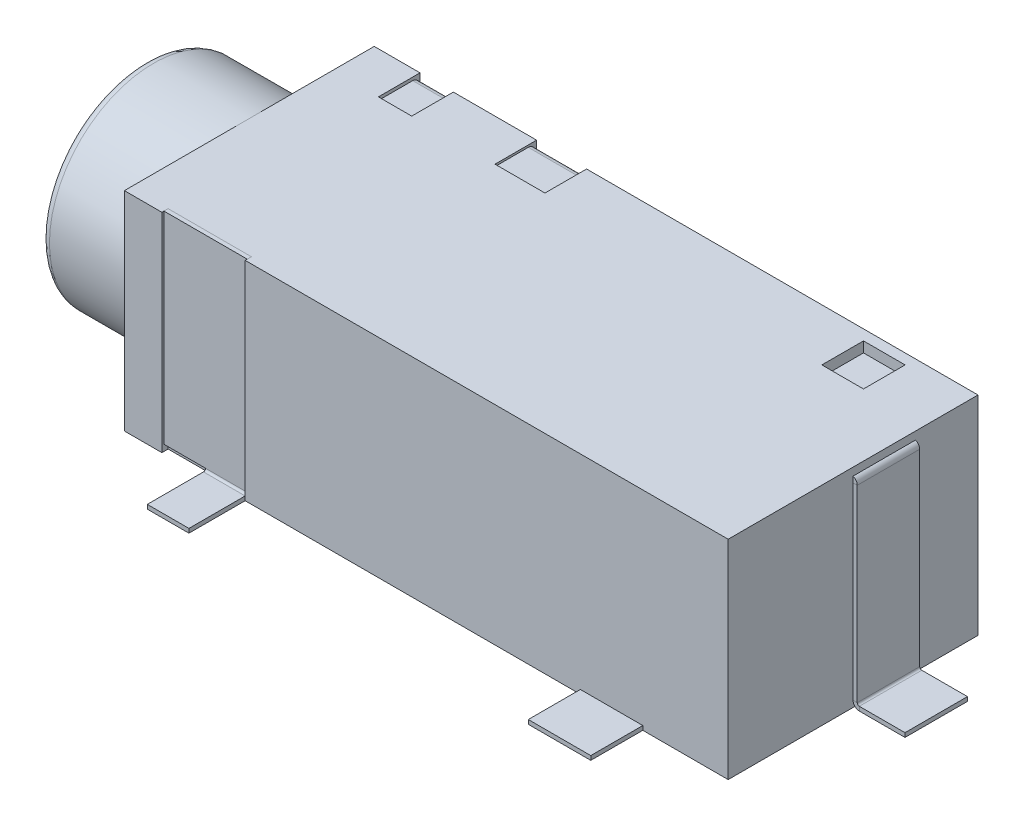
from build123d import *

# Parameters (mm, degrees)
SKETCH1_W               = 14.5
SKETCH1_H               = 6
BOSS_EXTRUDE1_DEPTH     = 5
SKETCH2_R               = 2.5
SKETCH2_R_2             = 1.8
BOSS_EXTRUDE2_DEPTH     = 2.5
CUT_EXTRUDE1_START      = -13.5
SKETCH2_2_R             = 1.8
CUT_EXTRUDE1_DEPTH      = 13.5
SKETCH3_W               = 1
SKETCH3_H               = 1
CUT_EXTRUDE2_DEPTH      = 0.25
BASE_FLANGE1_DEPTH      = 0.75
SKETCH9_W               = 1.25
SKETCH9_H               = 0.1
BASE_FLANGE2_DEPTH      = 0.75
CUT_EXTRUDE3_DEPTH      = 0.15
BASE_FLANGE3_DEPTH      = 0.5
SKETCH17_W              = 0.1
SKETCH17_H              = 4.85
BOSS_EXTRUDE3_DEPTH     = 1
SKETCH20_W              = 0.8
SKETCH20_H              = 1
CUT_EXTRUDE4_DEPTH      = 0.15
SKETCH21_W              = 0.8
SKETCH21_H              = 5
CUT_EXTRUDE5_DEPTH      = 0.15
BASE_FLANGE4_DEPTH      = 0.375
CUT_EXTRUDE6_DEPTH      = 0.15
SKETCH27_W              = 1.2
SKETCH27_H              = 1
CUT_EXTRUDE7_DEPTH      = 0.15
BASE_FLANGE5_DEPTH      = 0.4
BASE_FLANGE5_DEPTH_BACK = 0.8
SKETCH31_W              = 0.45
SKETCH31_H              = 1.5
CUT_EXTRUDE8_DEPTH      = 0.15
CHAMFER1_SIZE           = 0.2
FILLET1_R               = 0.2
SKETCH33_R              = 1
BOSS_EXTRUDE4_DEPTH     = 0.8
CHAMFER2_SIZE           = 0.25


# Sheet-metal steps are written as plain solids
with BuildPart() as part:
    # Sketch1 → Boss-Extrude1 (new body)
    with BuildSketch(Plane(origin=(0, 0, 0), x_dir=(1, 0, 0), z_dir=(0, 1, 0))):
        Rectangle(SKETCH1_W, SKETCH1_H)
    extrude(amount=BOSS_EXTRUDE1_DEPTH)

    # Sketch2 → Boss-Extrude2 (add)
    with BuildSketch(Plane.ZY.offset(7.25)):
        with Locations(Location((0, 2.5, 0), (0, 0, 270))):
            Circle(SKETCH2_R)
        with Locations((0, 2.5)):
            Circle(SKETCH2_R_2, mode=Mode.SUBTRACT)
    extrude(amount=BOSS_EXTRUDE2_DEPTH)

    # Sketch2<2> → Cut-Extrude1 (cut)
    with BuildSketch(Plane.ZY.offset(7.25).offset(CUT_EXTRUDE1_START)):
        with Locations((0, 2.5)):
            Circle(SKETCH2_2_R)
    extrude(amount=CUT_EXTRUDE1_DEPTH, mode=Mode.SUBTRACT)

    # Sketch3 → Cut-Extrude2 (cut)
    with BuildSketch(Plane(origin=(0, 5, 0), x_dir=(1, 0, 0), z_dir=(0, 1, 0))):
        with Locations((5.25, 2.25)):
            Rectangle(SKETCH3_W, SKETCH3_H)
    extrude(amount=-CUT_EXTRUDE2_DEPTH, mode=Mode.SUBTRACT)

    # Sketch13 → Cut-Extrude3 (cut)
    with BuildSketch(Plane.XY.offset(3)):
        Polygon((-6.35, 5), (-4.85, 5), (-4.35, 5), (-4.35, 0), (-4.85, 0), (-6.35, 0), align=None)
    extrude(amount=-CUT_EXTRUDE3_DEPTH, mode=Mode.SUBTRACT)

    # Sketch20 → Cut-Extrude4 (cut)
    with BuildSketch(Plane(origin=(0, 5, 0), x_dir=(1, 0, 0), z_dir=(0, 1, 0))):
        with Locations((-5.75, 2.5)):
            Rectangle(SKETCH20_W, SKETCH20_H)
    extrude(amount=-CUT_EXTRUDE4_DEPTH, mode=Mode.SUBTRACT)

    # Sketch21 → Cut-Extrude5 (cut)
    with BuildSketch(Plane(origin=(0, 0, -3), x_dir=(-1, 0, 0), z_dir=(0, 0, -1))):
        with Locations((5.75, 2.5)):
            Rectangle(SKETCH21_W, SKETCH21_H)
    extrude(amount=-CUT_EXTRUDE5_DEPTH, mode=Mode.SUBTRACT)

    # Sketch26 → Cut-Extrude6 (cut)
    with BuildSketch(Plane(origin=(0, 0, -3), x_dir=(-1, 0, 0), z_dir=(0, 0, -1))):
        Polygon((2.95, 5), (3.35, 5), (3.35, 0), (2.95, 0), (2.15, 0), (2.15, 5), align=None)
    extrude(amount=-CUT_EXTRUDE6_DEPTH, mode=Mode.SUBTRACT)

    # Sketch27 → Cut-Extrude7 (cut)
    with BuildSketch(Plane(origin=(0, 5, 0), x_dir=(1, 0, 0), z_dir=(0, 1, 0))):
        with Locations((-2.75, 2.5)):
            Rectangle(SKETCH27_W, SKETCH27_H)
    extrude(amount=-CUT_EXTRUDE7_DEPTH, mode=Mode.SUBTRACT)

    # Chamfer1
    chamfer1_edges = [part.edges().sort_by_distance(p)[0] for p in [
        (-9.75, 2.5, -1.8),
    ]]
    chamfer(chamfer1_edges, length=CHAMFER1_SIZE)

    # Fillet1
    fillet1_edges = [part.edges().sort_by_distance(p)[0] for p in [
        (-9.75, 5, 0),
    ]]
    fillet(fillet1_edges, radius=FILLET1_R)

    # Sketch33 → Boss-Extrude4 (add)
    with BuildSketch(Plane.XZ):
        with Locations(Location((-3.75, 0, 0), (0, 0, 270))):
            Circle(SKETCH33_R)
        with Locations(Location((3.25, 0, 0), (0, 0, 270))):
            Circle(SKETCH33_R)
    extrude(amount=BOSS_EXTRUDE4_DEPTH)

    # Chamfer2
    chamfer2_edges = [part.edges().sort_by_distance(p)[0] for p in [
        (-3.75, -0.8, 1),
        (3.25, -0.8, 1),
    ]]
    chamfer(chamfer2_edges, length=CHAMFER2_SIZE)


with BuildPart() as body_2:
    # Sketch4 → Base-Flange1 (new, symmetric)
    with BuildSketch(Plane.XY.offset(-0.75)):
        with BuildLine():
            Line((7.077702631, 4.721178133), (7.2, 4.721178133))
            ThreePointArc((7.2, 4.721178133), (7.235355339, 4.706533472), (7.25, 4.671178133))
            Line((7.25, 4.671178133), (7.25, 0.15))
            ThreePointArc((7.25, 0.15), (7.293933983, 0.043933983), (7.4, 0))
            Line((7.4, 0), (8.496675231, 0))
            Line((8.496675231, 0), (8.496675231, 0.1))
            Line((8.496675231, 0.1), (7.4, 0.1))
            ThreePointArc((7.4, 0.1), (7.364644661, 0.114644661), (7.35, 0.15))
            Line((7.35, 0.15), (7.35, 4.671178133))
            ThreePointArc((7.35, 4.671178133), (7.306066017, 4.77724415), (7.2, 4.821178133))
            Line((7.2, 4.821178133), (7.077702631, 4.821178133))
            Line((7.077702631, 4.821178133), (7.077702631, 4.721178133))
        make_face()
    extrude(amount=BASE_FLANGE1_DEPTH, both=True)


with BuildPart() as body_3:
    # Sketch9 → Base-Flange2 (new, symmetric)
    with BuildSketch(Plane.ZY.offset(-4.45)):
        with Locations((3.625, 0.05)):
            Rectangle(SKETCH9_W, SKETCH9_H)
    extrude(amount=BASE_FLANGE2_DEPTH, both=True)


with BuildPart() as body_4:
    # Sketch14 → Base-Flange3 (new, symmetric)
    with BuildSketch(Plane.ZY.offset(4.85)):
        with BuildLine():
            Line((2.85, 5), (2.85, 0.15))
            ThreePointArc((2.85, 0.15), (2.893933983, 0.043933983), (3, 0))
            Line((3, 0), (4.35, 0))
            Line((4.35, 0), (4.35, 0.1))
            Line((4.35, 0.1), (3, 0.1))
            ThreePointArc((3, 0.1), (2.964644661, 0.114644661), (2.95, 0.15))
            Line((2.95, 0.15), (2.95, 5))
            Line((2.95, 5), (2.85, 5))
        make_face()
    extrude(amount=BASE_FLANGE3_DEPTH, both=True)

    # Sketch17 → Boss-Extrude3 (add)
    with BuildSketch(Plane.ZY.offset(5.35)):
        with Locations((2.9, 2.575)):
            Rectangle(SKETCH17_W, SKETCH17_H)
    extrude(amount=BOSS_EXTRUDE3_DEPTH)


with BuildPart() as body_5:
    # Sketch22 → Base-Flange4 (new, symmetric)
    with BuildSketch(Plane.ZY.offset(5.75)):
        with BuildLine():
            Line((-2, 4.85), (-2.8, 4.85))
            ThreePointArc((-2.8, 4.85), (-2.835355339, 4.835355339), (-2.85, 4.8))
            Line((-2.85, 4.8), (-2.85, 0.15))
            ThreePointArc((-2.85, 0.15), (-2.893933983, 0.043933983), (-3, 0))
            Line((-3, 0), (-4.35, 0))
            Line((-4.35, 0), (-4.35, 0.1))
            Line((-4.35, 0.1), (-3, 0.1))
            ThreePointArc((-3, 0.1), (-2.964644661, 0.114644661), (-2.95, 0.15))
            Line((-2.95, 0.15), (-2.95, 4.8))
            ThreePointArc((-2.95, 4.8), (-2.906066017, 4.906066017), (-2.8, 4.95))
            Line((-2.8, 4.95), (-2, 4.95))
            Line((-2, 4.95), (-2, 4.85))
        make_face()
    extrude(amount=BASE_FLANGE4_DEPTH, both=True)


with BuildPart() as body_6:
    # Sketch28 → Base-Flange5 (new, two sides: drawn at the far end of the back side and taken through both)
    with BuildSketch(Plane.ZY.offset(2.95).offset(-BASE_FLANGE5_DEPTH_BACK)):
        with BuildLine():
            Line((-2, 4.85), (-2.8, 4.85))
            ThreePointArc((-2.8, 4.85), (-2.835355339, 4.835355339), (-2.85, 4.8))
            Line((-2.85, 4.8), (-2.85, 0.15))
            ThreePointArc((-2.85, 0.15), (-2.893933983, 0.043933983), (-3, 0))
            Line((-3, 0), (-4.35, 0))
            Line((-4.35, 0), (-4.35, 0.1))
            Line((-4.35, 0.1), (-3, 0.1))
            ThreePointArc((-3, 0.1), (-2.964644661, 0.114644661), (-2.95, 0.15))
            Line((-2.95, 0.15), (-2.95, 4.8))
            ThreePointArc((-2.95, 4.8), (-2.906066017, 4.906066017), (-2.8, 4.95))
            Line((-2.8, 4.95), (-2, 4.95))
            Line((-2, 4.95), (-2, 4.85))
        make_face()
    extrude(amount=BASE_FLANGE5_DEPTH + BASE_FLANGE5_DEPTH_BACK)

    # Sketch31 → Cut-Extrude8 (cut)
    with BuildSketch(Plane.XZ):
        with Locations((-2.375, -3.6)):
            Rectangle(SKETCH31_W, SKETCH31_H)
    extrude(amount=-CUT_EXTRUDE8_DEPTH, mode=Mode.SUBTRACT)


solid = Compound([part.part, body_2.part, body_3.part, body_4.part, body_5.part, body_6.part])
